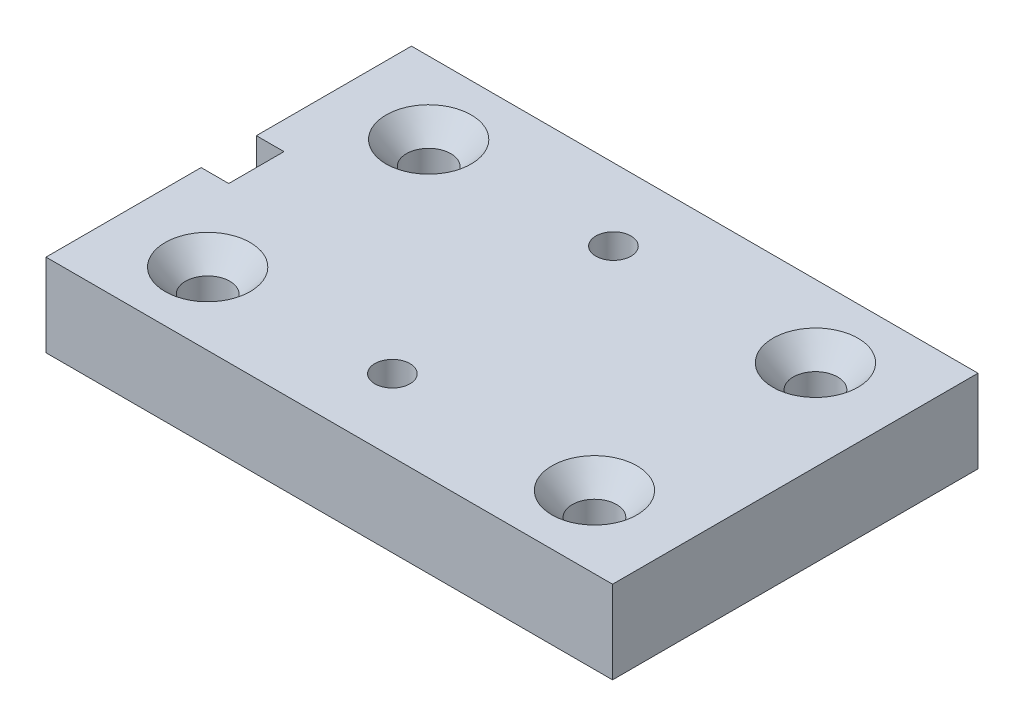
from build123d import *

# Parameters (mm, degrees)
SKETCH2_W                                       = 65.110000082
SKETCH2_H                                       = 42
BOSS_EXTRUDE1_DEPTH                             = 9.525
CSK_FOR_10_FLAT_HEAD_MACHINE_SCREW1_D           = 5.1054
CSK_FOR_10_FLAT_HEAD_MACHINE_SCREW1_CSINK_D     = 9.779
CSK_FOR_10_FLAT_HEAD_MACHINE_SCREW1_CSINK_ANGLE = 82
SKETCH15_W                                      = 3.175
SKETCH15_H                                      = 6.35
CUT_EXTRUDE1_DEPTH                              = 79.064317942
ADVANCEDHOLE2_OUTLINE_R                         = 2.0193
ADVANCEDHOLE2_DEPTH                             = 9.525


# Read off the part's stored shape, not the designer's step: AdvancedHole2
with BuildPart() as part:
    # Sketch2 → Boss-Extrude1 (new body)
    with BuildSketch(Plane(origin=(0, 0, 0), x_dir=(1, 0, 0), z_dir=(0, 1, 0))):
        with Locations((-32.555000041, 21)):
            Rectangle(SKETCH2_W, SKETCH2_H)
    extrude(amount=BOSS_EXTRUDE1_DEPTH)

    # CSK for #10 Flat Head Machine Screw1 (through all)
    with Locations(Plane(origin=(0, 9.525, 0), x_dir=(1, 0, 0), z_dir=(0, 1, 0))):
        with Locations((-54.830000082, 33.7), (-54.830000082, 8.3), (-10.3799894, 8.3), (-10.3799894, 33.7)):
            CounterSinkHole(CSK_FOR_10_FLAT_HEAD_MACHINE_SCREW1_D / 2, CSK_FOR_10_FLAT_HEAD_MACHINE_SCREW1_CSINK_D / 2, counter_sink_angle=CSK_FOR_10_FLAT_HEAD_MACHINE_SCREW1_CSINK_ANGLE)

    # Sketch15 → Cut-Extrude1 (cut, through all)
    with BuildSketch(Plane(origin=(0, 9.525, 0), x_dir=(1, 0, 0), z_dir=(0, 1, 0))):
        with Locations((-63.522500082, 21)):
            Rectangle(SKETCH15_W, SKETCH15_H)
    extrude(amount=-CUT_EXTRUDE1_DEPTH, mode=Mode.SUBTRACT)

    # AdvancedHole2 outline → AdvancedHole2 (cut)
    with BuildSketch(Plane(origin=(0, 0, 0), x_dir=(1, 0, 0), z_dir=(0, 1, 0))):
        with Locations((-33.600000082, 8.3)):
            Circle(ADVANCEDHOLE2_OUTLINE_R)
        with Locations((-33.600000082, 33.7)):
            Circle(ADVANCEDHOLE2_OUTLINE_R)
    extrude(amount=ADVANCEDHOLE2_DEPTH, mode=Mode.SUBTRACT)


solid = part.part
